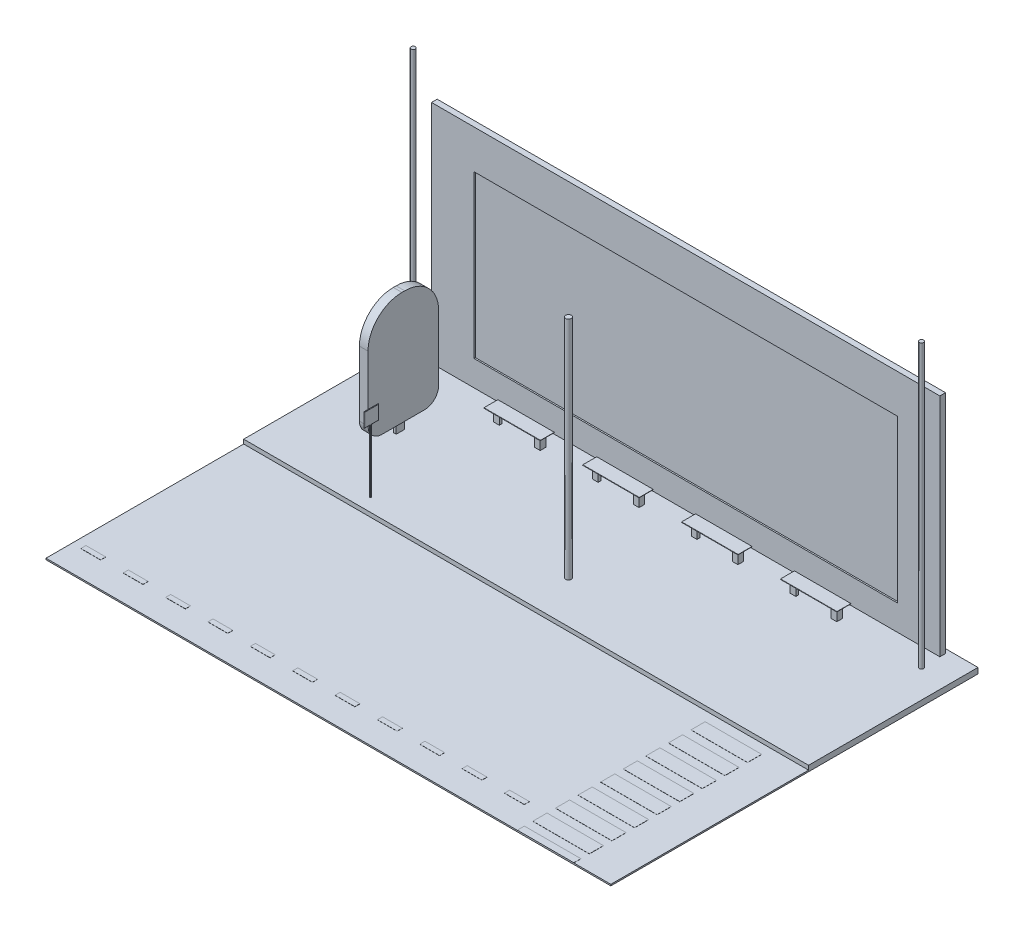
from build123d import *

# Parameters (mm, degrees)
SKETCH1_W                   = 20000
SKETCH1_H                   = 13000
BOSS_EXTRUDE1_DEPTH         = 200
SKETCH2_W                   = 20000
SKETCH2_H                   = 7000
CALLE_DEPTH                 = 150
SKETCH5_W                   = 700
SKETCH5_H                   = 181.01662115
SKETCH5_W_2                 = 2000
SKETCH5_H_2                 = 500
SKETCH5_H_3                 = 250
RAYAS_DE_TRAFICO_DEPTH      = 5
SKETCH6_W                   = 40
SKETCH6_H                   = 40
POSTE_DE_LA_SE_AL_DEPTH     = 2500
SKETCH8_W                   = 500
SKETCH8_H                   = 500
SE_AL_DE_ALTO_DEPTH         = 20
FILLET2_R                   = 10
SKETCH9_R                   = 75
PILARES_EXTERNOS_DEPTH      = 10000
SKETCH10_R                  = 100
PILAR_CENTRAL_DEPTH         = 8000
SKETCH22_W                  = 200
SKETCH22_H                  = 100
SKETCH22_H_2                = 200
PATAS_DE_LAS_BANCAS_DEPTH   = 450
SKETCH23_W                  = 2000
SKETCH23_H                  = 500
ASIENTO_DE_LAS_BANCAS_DEPTH = 10
FILLET3_R                   = 10
SKETCH24_W                  = 18000
SKETCH24_H                  = 200
MURO_DE_SEPARACI_N_DEPTH    = 8000
HUECO_VENTANA_REACH         = 23989.757
SKETCH26_W                  = 15000
SKETCH26_H                  = 5727.998746355
VENTANA_REACH               = 20770.004
SKETCH27_W                  = 15000
SKETCH27_H                  = 100
SKETCH28_W                  = 100
SKETCH28_H                  = 300
BOSS_EXTRUDE13_DEPTH        = 350
SKETCH29_W                  = 305.088397776
SKETCH29_H                  = 2500
BOSS_EXTRUDE14_DEPTH        = 4000
FILLET4_R                   = 1200
FILLET5_R                   = 500


with BuildPart() as part:
    # Sketch1 → Boss-Extrude1 (new body)
    with BuildSketch(Plane(origin=(0, 0, 0), x_dir=(1, 0, 0), z_dir=(0, 1, 0))):
        with Locations((7500, 0)):
            Rectangle(SKETCH1_W, SKETCH1_H)
    extrude(amount=BOSS_EXTRUDE1_DEPTH)

    # Sketch2 → Calle (cut)
    with BuildSketch(Plane(origin=(0, 200, 0), x_dir=(1, 0, 0), z_dir=(0, 1, 0))):
        with Locations((7500, -3000)):
            Rectangle(SKETCH2_W, SKETCH2_H)
    extrude(amount=-CALLE_DEPTH, mode=Mode.SUBTRACT)

    # Sketch5 → Rayas de trafico (add)
    with BuildSketch(Plane(origin=(0, 50, 0), x_dir=(1, 0, 0), z_dir=(0, 1, 0))):
        with Locations((-325.012132161, -5500)):
            Rectangle(SKETCH5_W, SKETCH5_H)
        with Locations((15189.040037428, -5700)):
            Rectangle(SKETCH5_W_2, SKETCH5_H_2)
        with Locations((15189.040037428, -6375)):
            Rectangle(SKETCH5_W_2, SKETCH5_H_3)
        with Locations((15189.040037428, -4900)):
            Rectangle(SKETCH5_W_2, SKETCH5_H_2)
        with Locations((15189.040037428, -4100)):
            Rectangle(SKETCH5_W_2, SKETCH5_H_2)
        with Locations((15189.040037428, -3300)):
            Rectangle(SKETCH5_W_2, SKETCH5_H_2)
        with Locations((15189.040037428, -2500)):
            Rectangle(SKETCH5_W_2, SKETCH5_H_2)
        with Locations((15189.040037428, -1700)):
            Rectangle(SKETCH5_W_2, SKETCH5_H_2)
        with Locations((15189.040037428, -900)):
            Rectangle(SKETCH5_W_2, SKETCH5_H_2)
        with Locations((15189.040037428, -100)):
            Rectangle(SKETCH5_W_2, SKETCH5_H_2)
        with Locations((-1825.012132161, -5500)):
            Rectangle(SKETCH5_W, SKETCH5_H)
        with Locations((1174.987867839, -5500)):
            Rectangle(SKETCH5_W, SKETCH5_H)
        with Locations((2674.987867839, -5500)):
            Rectangle(SKETCH5_W, SKETCH5_H)
        with Locations((4174.987867839, -5500)):
            Rectangle(SKETCH5_W, SKETCH5_H)
        with Locations((5674.987867839, -5500)):
            Rectangle(SKETCH5_W, SKETCH5_H)
        with Locations((7174.987867839, -5500)):
            Rectangle(SKETCH5_W, SKETCH5_H)
        with Locations((8674.987867839, -5500)):
            Rectangle(SKETCH5_W, SKETCH5_H)
        with Locations((10174.987867839, -5500)):
            Rectangle(SKETCH5_W, SKETCH5_H)
        with Locations((11674.987867839, -5500)):
            Rectangle(SKETCH5_W, SKETCH5_H)
        with Locations((13174.987867839, -5500)):
            Rectangle(SKETCH5_W, SKETCH5_H)
    extrude(amount=RAYAS_DE_TRAFICO_DEPTH)

    # Sketch6 → Poste de la señal (add)
    with BuildSketch(Plane(origin=(0, 200, 0), x_dir=(1, 0, 0), z_dir=(0, 1, 0))):
        with Locations((1520, 967.665116362)):
            Rectangle(SKETCH6_W, SKETCH6_H)
    extrude(amount=POSTE_DE_LA_SE_AL_DEPTH)

    # Sketch8 → Señal de alto (add)
    with BuildSketch(Plane(origin=(1540, 0, 0), x_dir=(0, 0, -1), z_dir=(1, 0, 0))):
        with Locations((967.665116362, 2700)):
            Rectangle(SKETCH8_W, SKETCH8_H)
    extrude(amount=SE_AL_DE_ALTO_DEPTH)

    # Fillet2
    fillet2_edges = [part.edges().sort_by_distance(p)[0] for p in [
        (1560, 2700, -1217.665116362),
        (1560, 2950, -967.665116362),
        (1560, 2700, -717.665116362),
        (1560, 2450, -967.665116362),
    ]]
    fillet(fillet2_edges, radius=FILLET2_R)

    # Sketch9 → Pilares externos (add)
    with BuildSketch(Plane(origin=(0, 200, 0), x_dir=(1, 0, 0), z_dir=(0, 1, 0))):
        with Locations(Location((-1500, 5500, 0), (0, 0, 90))):
            Circle(SKETCH9_R)
        with Locations(Location((16500, 5500, 0), (0, 0, 90))):
            Circle(SKETCH9_R)
    extrude(amount=PILARES_EXTERNOS_DEPTH)

    # Sketch10 → Pilar central (add)
    with BuildSketch(Plane(origin=(0, 200, 0), x_dir=(1, 0, 0), z_dir=(0, 1, 0))):
        with Locations(Location((7500, 2000, 0), (0, 0, 90))):
            Circle(SKETCH10_R)
    extrude(amount=PILAR_CENTRAL_DEPTH)

    # Sketch22 → Patas de las bancas (add)
    with BuildSketch(Plane(origin=(0, 200, 0), x_dir=(1, 0, 0), z_dir=(0, 1, 0))):
        with Locations((1500, 5500)):
            Rectangle(SKETCH22_W, SKETCH22_H)
        with Locations((5000, 5500)):
            Rectangle(SKETCH22_W, SKETCH22_H)
        with Locations((3000, 5500)):
            Rectangle(SKETCH22_W, SKETCH22_H_2)
        with Locations((6500, 5500)):
            Rectangle(SKETCH22_W, SKETCH22_H_2)
        with Locations((8500, 5500)):
            Rectangle(SKETCH22_W, SKETCH22_H)
        with Locations((10000, 5500)):
            Rectangle(SKETCH22_W, SKETCH22_H_2)
        with Locations((12000, 5500)):
            Rectangle(SKETCH22_W, SKETCH22_H)
        with Locations((13500, 5500)):
            Rectangle(SKETCH22_W, SKETCH22_H_2)
    extrude(amount=PATAS_DE_LAS_BANCAS_DEPTH)

    # Sketch23 → Asiento de las bancas (add)
    with BuildSketch(Plane(origin=(0, 650, 0), x_dir=(1, 0, 0), z_dir=(0, 1, 0))):
        with Locations((5750, 5500)):
            Rectangle(SKETCH23_W, SKETCH23_H)
        with Locations((2250, 5500)):
            Rectangle(SKETCH23_W, SKETCH23_H)
        with Locations((9250, 5500)):
            Rectangle(SKETCH23_W, SKETCH23_H)
        with Locations((12750, 5500)):
            Rectangle(SKETCH23_W, SKETCH23_H)
    extrude(amount=ASIENTO_DE_LAS_BANCAS_DEPTH)

    # Fillet3
    fillet3_edges = [part.edges().sort_by_distance(p)[0] for p in [
        (12750, 660, -5250),
        (9250, 660, -5250),
        (5750, 660, -5250),
        (2250, 660, -5250),
    ]]
    fillet(fillet3_edges, radius=FILLET3_R - 0.0001)  # a hair under: the kernel refuses the full size

    # Sketch24 → Muro de separación (add)
    with BuildSketch(Plane(origin=(0, 200, 0), x_dir=(1, 0, 0), z_dir=(0, 1, 0))):
        with Locations((7500, 6250)):
            Rectangle(SKETCH24_W, SKETCH24_H)
    extrude(amount=MURO_DE_SEPARACI_N_DEPTH)

    # Sketch26 → Hueco ventana (cut, up to next)
    with BuildSketch(Plane(origin=(0, 0, -6350), x_dir=(-1, 0, 0), z_dir=(0, 0, -1)), mode=Mode.PRIVATE) as hueco_ventana_sk1:
        with Locations((-7500, 3963.999373178)):
            Rectangle(SKETCH26_W, SKETCH26_H)
    hueco_ventana_tool1 = extrude(hueco_ventana_sk1.sketch, amount=-HUECO_VENTANA_REACH, mode=Mode.PRIVATE) & part.part
    add(hueco_ventana_tool1.solids().sort_by_distance((7500, 3963.999373, -6350))[0], mode=Mode.SUBTRACT)

    # Sketch27 → Ventana (add, up to next)
    with BuildSketch(Plane(origin=(0, 1100, 0), x_dir=(1, 0, 0), z_dir=(0, 1, 0)), mode=Mode.PRIVATE) as ventana_sk1:
        with Locations((7500, 6250)):
            Rectangle(SKETCH27_W, SKETCH27_H)
    ventana_tool1 = extrude(ventana_sk1.sketch, amount=VENTANA_REACH, mode=Mode.PRIVATE) - part.part
    add(ventana_tool1.solids().sort_by_distance((7500, 1100, -6250))[0])

    # Sketch28 → Boss-Extrude13 (add)
    with BuildSketch(Plane(origin=(0, 200, 0), x_dir=(1, 0, 0), z_dir=(0, 1, 0))):
        with Locations((0, 3500)):
            Rectangle(SKETCH28_W, SKETCH28_H)
    extrude(amount=BOSS_EXTRUDE13_DEPTH)

    # Sketch29 → Boss-Extrude14 (add)
    with BuildSketch(Plane(origin=(0, 550, 0), x_dir=(1, 0, 0), z_dir=(0, 1, 0))):
        with Locations((0, 3500)):
            Rectangle(SKETCH29_W, SKETCH29_H)
    extrude(amount=BOSS_EXTRUDE14_DEPTH)

    # Fillet4
    fillet4_edges = [part.edges().sort_by_distance(p)[0] for p in [
        (0, 4550, -2250),
        (0, 4550, -4750),
    ]]
    fillet(fillet4_edges, radius=FILLET4_R)

    # Fillet5
    fillet5_edges = [part.edges().sort_by_distance(p)[0] for p in [
        (0, 550, -2250),
        (0, 550, -4750),
    ]]
    fillet(fillet5_edges, radius=FILLET5_R)


solid = part.part
